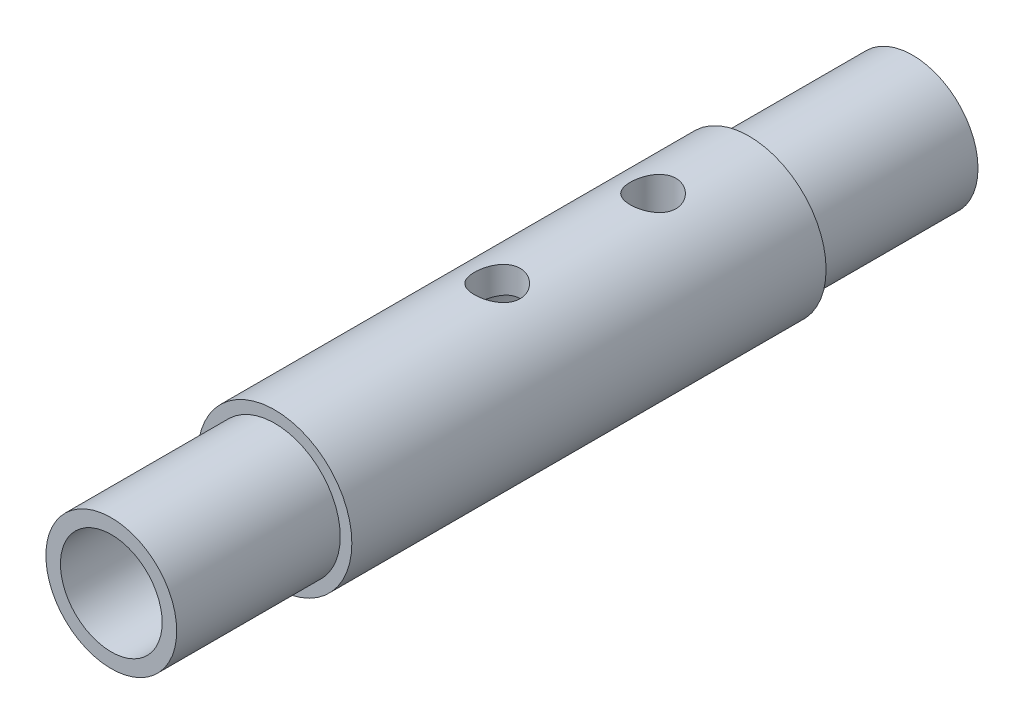
from build123d import *

# Parameters (mm, degrees)
SKETCH1_R               = 4
EXTRUDE1_DEPTH          = 10
SKETCH4_R               = 4.71
EXTRUDE2_DEPTH          = 29
SKETCH2_R               = 2.5
CUT_EXTRUDE1_DEPTH      = 20
SKETCH5_R               = 4
EXTRUDE3_DEPTH          = 10
SKETCH6_R               = 3.11
CUT_EXTRUDE2_DEPTH      = 29
CUT_EXTRUDE3_DEPTH      = 50.450664303
CUT_EXTRUDE3_DEPTH_BACK = 50.450664303
SKETCH7_R               = 1.4


with BuildPart() as part:
    # Sketch1 → Extrude1 (new body)
    with BuildSketch(Plane.XY):
        Circle(SKETCH1_R)
    extrude(amount=EXTRUDE1_DEPTH)

    # Sketch4 → Extrude2 (add)
    with BuildSketch(Plane.XY.offset(10)):
        Circle(SKETCH4_R)
    extrude(amount=EXTRUDE2_DEPTH)

    # Sketch2 → Cut-Extrude1 (cut)
    with BuildSketch(Plane(origin=(0, 0, 0), x_dir=(-1, 0, 0), z_dir=(0, 0, -1))):
        Circle(SKETCH2_R)
    extrude(amount=-CUT_EXTRUDE1_DEPTH, mode=Mode.SUBTRACT)

    # Sketch5 → Extrude3 (add)
    with BuildSketch(Plane.XY.offset(39)):
        Circle(SKETCH5_R)
    extrude(amount=EXTRUDE3_DEPTH)

    # Sketch6 → Cut-Extrude2 (cut)
    with BuildSketch(Plane.XY.offset(49)):
        Circle(SKETCH6_R)
    extrude(amount=-CUT_EXTRUDE2_DEPTH, mode=Mode.SUBTRACT)

    # Sketch7 → Cut-Extrude3 (cut, two sides: drawn at the far end of the back side and taken through both)
    with BuildSketch(Plane(origin=(0, 0, 0), x_dir=(1, 0, 0), z_dir=(0, 1, 0)).offset(-CUT_EXTRUDE3_DEPTH_BACK)):
        with Locations((0, -15.87)):
            Circle(SKETCH7_R)
        with Locations((0, -25.4)):
            Circle(SKETCH7_R)
    extrude(amount=CUT_EXTRUDE3_DEPTH + CUT_EXTRUDE3_DEPTH_BACK, mode=Mode.SUBTRACT)


solid = part.part
